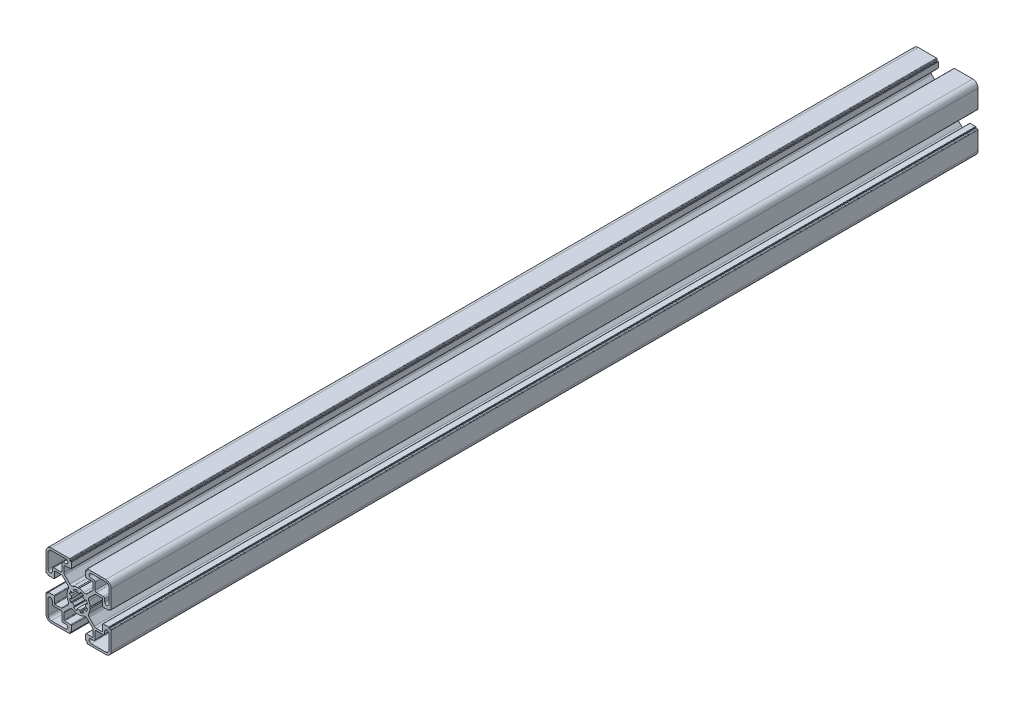
from build123d import *

# Parameters (mm, degrees)
BOSS_EXTRUDE1_DEPTH      = 1524
FILLET4_R                = 1.885
FILLET5_R                = 0.377
DELETEFACE1_START        = -1524
DELETEFACE1_DEPTH        = 3048
CUT_EXTRUDE1_DEPTH       = 1525.332148844
CIRPATTERN2_COUNT        = 3
CIRPATTERN2_ANGLE        = 180
FILLET2_R                = 0.377
FILLET3_R                = 0.1885
CUT_EXTRUDE2_DEPTH       = 3049.166087995
CUT_EXTRUDE2_DEPTH_BACK  = 3049.166087995
SKETCH5_R                = 6.375
BOSS_EXTRUDE2_DEPTH      = 1524
FILLET6_R                = 0.377
CIRPATTERN1_COUNT        = 8
FILLET6_OF_CIRPATTERN1_R = 0.377
CUT_EXTRUDE3_DEPTH       = 1525.332148844
CUT_EXTRUDE3_DEPTH_BACK  = 1525.332148844
SKETCH8_W                = 45.58785463
SKETCH8_H                = 45.645707238
CUT_EXTRUDE4_DEPTH       = 2448


# Read off the part's stored shape, not the designer's step: DeleteFace1
with BuildPart() as part:
    # Sketch3 → Boss-Extrude1 (new, symmetric)
    with BuildSketch(Plane.XY):
        with BuildLine():
            Line((0, -8), (0, -5))
            ThreePointArc((0, -5), (3.535533906, -3.535533906), (5, 0))
            Line((5, 0), (8, 0))
            ThreePointArc((8, 0), (7.57237156, -2.58054044), (6.335202759, -4.885202759))
            Line((6.335202759, -4.885202759), (11.5, -10.05))
            Line((11.5, -10.05), (16.7, -10.05))
            Line((16.7, -10.05), (16.7, -5))
            Line((16.7, -5), (21.05, -5))
            Line((21.05, -5), (21.05, 0))
            Line((21.05, 0), (22.5, 0))
            Line((22.5, 0), (22.5, -18.875))
            ThreePointArc((22.5, -18.875), (21.438262082, -21.438262082), (18.875, -22.5))
            Line((18.875, -22.5), (0, -22.5))
            Line((0, -22.5), (0, -21.05))
            Line((0, -21.05), (5, -21.05))
            Line((5, -21.05), (5, -16.7))
            Line((5, -16.7), (10.05, -16.7))
            Line((10.05, -16.7), (10.05, -11.5))
            Line((10.05, -11.5), (4.885202759, -6.335202759))
            ThreePointArc((4.885202759, -6.335202759), (2.58054044, -7.57237156), (0, -8))
        make_face()
        with BuildLine():
            Line((18.15, -8.79375), (18.15, -10.5575))
            ThreePointArc((18.15, -10.5575), (17.873948141, -11.223948141), (17.2075, -11.5))
            Line((17.2075, -11.5), (12.4425, -11.5))
            ThreePointArc((12.4425, -11.5), (11.776051859, -11.776051859), (11.5, -12.4425))
            Line((11.5, -12.4425), (11.5, -17.2075))
            ThreePointArc((11.5, -17.2075), (11.223948141, -17.873948141), (10.5575, -18.15))
            Line((10.5575, -18.15), (8.79375, -18.15))
            ThreePointArc((8.79375, -18.15), (7.34375, -19.6), (8.79375, -21.05))
            Line((8.79375, -21.05), (18.875, -21.05))
            ThreePointArc((18.875, -21.05), (20.412957249, -20.412957249), (21.05, -18.875))
            Line((21.05, -18.875), (21.05, -8.79375))
            ThreePointArc((21.05, -8.79375), (19.6, -7.34375), (18.15, -8.79375))
        make_face(mode=Mode.SUBTRACT)
    extrude(amount=BOSS_EXTRUDE1_DEPTH, both=True)

    # Fillet4
    fillet4_edges = [part.edges().sort_by_distance(p)[0] for p in [
        (10.05, -11.5, 0),
        (4.885202759, -6.335202759, 0),
        (6.335202759, -4.885202759, 0),
        (11.5, -10.05, 0),
    ]]
    fillet(fillet4_edges, radius=FILLET4_R)

    # Fillet5
    fillet5_edges = [part.edges().sort_by_distance(p)[0] for p in [
        (5, -21.05, 0),
        (5, -16.7, 0),
        (10.05, -16.7, 0),
        (16.7, -10.05, 0),
        (16.7, -5, 0),
        (21.05, -5, 0),
    ]]
    fillet(fillet5_edges, radius=FILLET5_R)

    # Mirror1: part across plane


with BuildPart() as part_1:
    add(part.part)
    add(part.part.mirror(Plane.ZX))

    # DeleteFace1 outline → DeleteFace1 (cut)
    with BuildSketch(Plane.XY.offset(DELETEFACE1_START)):
        with BuildLine():
            ThreePointArc((4.623, 21.05), (4.889579257, 20.939579257), (5, 20.673))
            Line((5, 20.673), (5, 21.05))
            Line((5, 21.05), (4.623, 21.05))
        make_face()
    extrude(amount=DELETEFACE1_DEPTH, mode=Mode.SUBTRACT)

    # Sketch4 → Cut-Extrude1 (cut, symmetric)
    with BuildSketch(Plane.XY):
        Polygon((5.85, 21.05), (5.85, 22.5), (0, 22.5), (-5.85, 22.5), (-5.85, 21.05), (-5, 21.05), (-5, 16.7), (5, 16.7), (5, 21.05), align=None)
    cut_extrude1 = extrude(amount=CUT_EXTRUDE1_DEPTH, both=True, mode=Mode.SUBTRACT)

    # CirPattern2: Cut-Extrude1 ×3 about axis
    cirpattern2_axis = Axis((0, 0, 1489), (0, 0, -1))
    for i in range(1, CIRPATTERN2_COUNT):
        add(cut_extrude1.rotate(cirpattern2_axis, i * CIRPATTERN2_ANGLE / (CIRPATTERN2_COUNT - 1)), mode=Mode.SUBTRACT)

    # Fillet2
    fillet2_edges = [part_1.edges().sort_by_distance(p)[0] for p in [
        (5.85, 22.5, 0),
        (22.5, 5.85, 0),
        (22.5, -5.85, 0),
        (5.85, -22.5, 0),
    ]]
    fillet(fillet2_edges, radius=FILLET2_R)

    # Fillet3
    fillet3_edges = [part_1.edges().sort_by_distance(p)[0] for p in [
        (5, 21.05, 0),
        (5.85, 21.05, 0),
        (21.05, -5, 0),
        (21.05, -5.85, 0),
        (21.05, 5, 0),
        (21.05, 5.85, 0),
        (5, -21.05, 0),
        (5.85, -21.05, 0),
    ]]
    fillet(fillet3_edges, radius=FILLET3_R)

    # Mirror2: part across plane


with BuildPart() as part_2:
    add(part_1.part)
    add(part_1.part.mirror(Plane(origin=(0, 0, 0), x_dir=(0, 0, 1), z_dir=(1, 0, 0))))

    # Sketch5 → Cut-Extrude2 (cut, two sides: drawn at the far end of the back side and taken through both)
    with BuildSketch(Plane.XY.offset(1524).offset(-CUT_EXTRUDE2_DEPTH_BACK)):
        Circle(SKETCH5_R)
        Polygon((-0.580185128, 8), (0.580185128, 8), (0, 7.59375), align=None)
        Polygon((-8, 0.580185128), (-8, -0.580185128), (-7.59375, 0), align=None)
        Polygon((8, 0.580185128), (8, -0.580185128), (7.59375, 0), align=None)
        Polygon((-0.580185128, -8), (0.580185128, -8), (0, -7.59375), align=None)
    extrude(amount=CUT_EXTRUDE2_DEPTH + CUT_EXTRUDE2_DEPTH_BACK, mode=Mode.SUBTRACT)

    # Sketch6 → Boss-Extrude2 (add, symmetric)
    with BuildSketch(Plane.XY):
        with BuildLine():
            Line((-0.97545161, -4.903926402), (-1.243700803, -6.252506163))
            ThreePointArc((-1.243700803, -6.252506163), (0, -6.375), (1.243700803, -6.252506163))
            Line((1.243700803, -6.252506163), (0.97545161, -4.903926402))
            ThreePointArc((0.97545161, -4.903926402), (0, -5), (-0.97545161, -4.903926402))
        make_face()
    boss_extrude2 = extrude(amount=BOSS_EXTRUDE2_DEPTH, both=True)

    # Fillet6
    fillet6_edges = [part_2.edges().sort_by_distance(p)[0] for p in [
        (-1.243700803, -6.252506163, 0),
        (1.243700803, -6.252506163, 0),
    ]]
    fillet(fillet6_edges, radius=FILLET6_R)

    # CirPattern1: Boss-Extrude2 ×8 about axis
    cirpattern1_axis = Axis((0, 0, 0), (0, 0, 1))
    for i in range(1, CIRPATTERN1_COUNT):
        add(boss_extrude2.rotate(cirpattern1_axis, i * 360 / CIRPATTERN1_COUNT))

    # Fillet6 of CirPattern1
    fillet6_of_cirpattern1_edges = [part_2.edges().sort_by_distance(p)[0] for p in [
        (3.541760235, -5.300618778, 0),
        (5.300618778, -3.541760235, 0),
        (6.252506163, -1.243700803, 0),
        (6.252506163, 1.243700803, 0),
        (5.300618778, 3.541760235, 0),
        (3.541760235, 5.300618778, 0),
        (1.243700803, 6.252506163, 0),
        (-1.243700803, 6.252506163, 0),
        (-3.541760235, 5.300618778, 0),
        (-5.300618778, 3.541760235, 0),
        (-6.252506163, 1.243700803, 0),
        (-6.252506163, -1.243700803, 0),
        (-5.300618778, -3.541760235, 0),
        (-3.541760235, -5.300618778, 0),
    ]]
    fillet(fillet6_of_cirpattern1_edges, radius=FILLET6_OF_CIRPATTERN1_R)

    # Sketch7 → Cut-Extrude3 (cut, two sides: drawn at the far end of the back side and taken through both)
    with BuildSketch(Plane.XY.offset(-CUT_EXTRUDE3_DEPTH_BACK)):
        Polygon((-7.031875, 16.7), (-6.596875, 17.135), (-6.161875, 16.7), align=None)
    extrude(amount=CUT_EXTRUDE3_DEPTH + CUT_EXTRUDE3_DEPTH_BACK, mode=Mode.SUBTRACT)

    # Sketch8 → Cut-Extrude4 (cut)
    with BuildSketch(Plane.XY.offset(1524)):
        Rectangle(SKETCH8_W, SKETCH8_H)
    extrude(amount=-CUT_EXTRUDE4_DEPTH, mode=Mode.SUBTRACT)


solid = part_2.part
